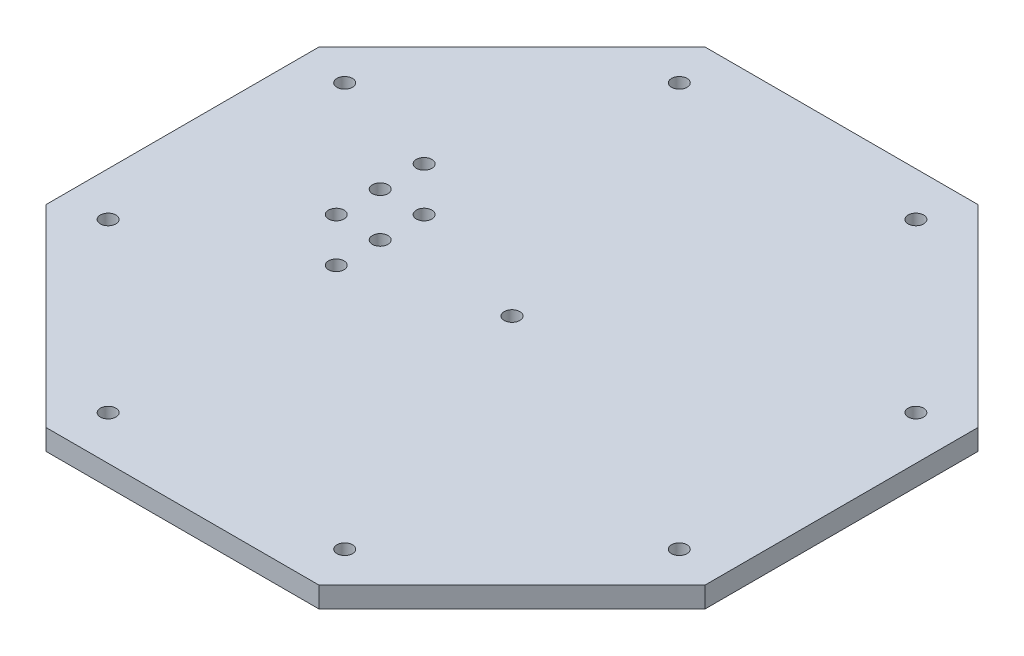
from build123d import *

# Parameters (mm, degrees)
BASE_DEPTH            = 5.9944
MOUNTING_HOLES_D      = 4.4958
F_8_CLEARANCE_HOLE1_D = 4.4958


with BuildPart() as part:
    # Sketch1 → Base (new body)
    with BuildSketch(Plane(origin=(0, 0, 0), x_dir=(1, 0, 0), z_dir=(0, 1, 0))):
        Polygon((-39.453841816, 95.25), (-95.25, 39.453841816), (-95.25, -39.453841816), (-39.453841816, -95.25), (39.453841816, -95.25), (95.25, -39.453841816), (95.25, 39.453841816), (39.453841816, 95.25), align=None)
    extrude(amount=BASE_DEPTH)

    # Mounting holes (through all)
    with Locations(Plane(origin=(0, 5.9944, 0), x_dir=(1, 0, 0), z_dir=(0, 1, 0))):
        with Locations((-34.193329574, 82.55), (34.193329574, 82.55), (82.55, 34.193329574), (82.55, -34.193329574), (34.193329574, -82.55), (-34.193329574, -82.55), (-82.55, -34.193329574), (-82.55, 34.193329574)):
            Hole(MOUNTING_HOLES_D / 2)

    # #8 Clearance Hole1 (through all)
    with Locations(Plane(origin=(0, 5.9944, 0), x_dir=(1, 0, 0), z_dir=(0, 1, 0))):
        with Locations((0, 0), (-38.1, 0), (-50.8, 0), (-50.8, 12.7), (-50.8, 25.4), (-38.1, 12.7), (-38.1, -12.7)):
            Hole(F_8_CLEARANCE_HOLE1_D / 2)


solid = part.part
